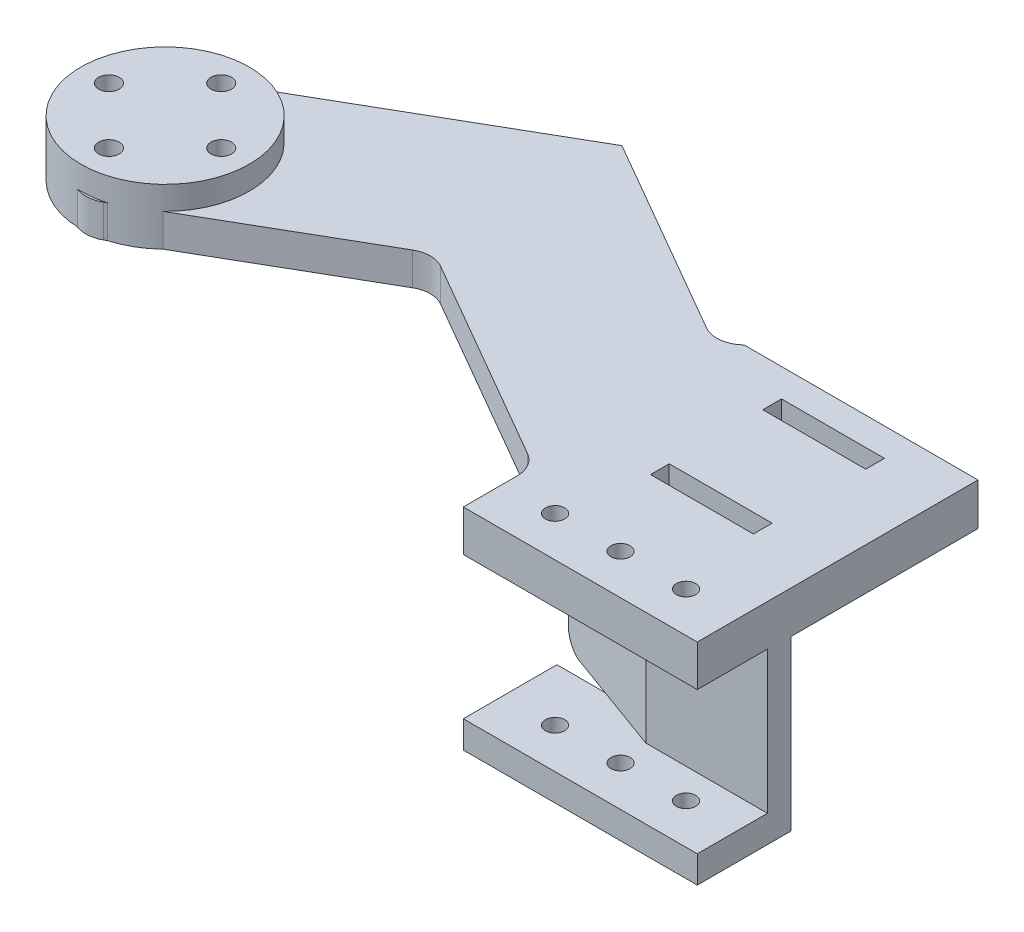
from build123d import *

# Parameters (mm, degrees)
SKETCH_1_W               = 25
SKETCH_1_H               = 10
EXTRUDE_1_DEPTH          = 22.5
SKETCH_2_W               = 25
SKETCH_2_H               = 15.2
CUT_EXTRUDE_1_DEPTH      = 7.5
CUT_EXTRUDE_2_DEPTH      = 36.089172119
CUT_EXTRUDE_2_DEPTH_BACK = 36.089172119
SKETCH_4_R               = 1.03
SKETCH_5_W               = 25
SKETCH_5_H               = 4.5
EXTRUDE_2_DEPTH          = 20
SKETCH_6_W               = 11
SKETCH_6_H               = 2
CUT_EXTRUDE_3_DEPTH      = 4.5
EXTRUDE_3_DEPTH          = 3.5
SKETCH_16_R              = 9
EXTRUDE_4_DEPTH          = 6
CUT_EXTRUDE_4_REACH      = 71.426
SKETCH_17_R              = 1.1
CUT_EXTRUDE_5_REACH      = 73.302
SKETCH_19_W              = 12
SKETCH_19_H              = 15.1
FILLET_7_R               = 3
EXTRUDE_6_REACH          = 72.338
CUT_EXTRUDE_6_REACH      = 72.847
SKETCH_22_W              = 7
SKETCH_22_H              = 5
FILLET_8_R               = 2


with BuildPart() as part:
    # 草图1 → 凸台-拉伸1 (new body)
    with BuildSketch(Plane(origin=(0, 0, 0), x_dir=(1, 0, 0), z_dir=(0, 1, 0))):
        with Locations((12.5, -5)):
            Rectangle(SKETCH_1_W, SKETCH_1_H)
    extrude(amount=EXTRUDE_1_DEPTH)

    # 草图2 → 切除-拉伸1 (cut)
    with BuildSketch(Plane.XY.offset(10)):
        with Locations((12.5, 10.5)):
            Rectangle(SKETCH_2_W, SKETCH_2_H)
    extrude(amount=-CUT_EXTRUDE_1_DEPTH, mode=Mode.SUBTRACT)

    # 草图4 → 切除-拉伸2 (cut, two sides: drawn at the far end of the back side and taken through both)
    with BuildSketch(Plane(origin=(0, 22.5, 0), x_dir=(1, 0, 0), z_dir=(0, 1, 0)).offset(-CUT_EXTRUDE_2_DEPTH_BACK)):
        with Locations(Location((12.5, -5.7, 0), (0, 0, 270))):
            Circle(SKETCH_4_R)
        with Locations(Location((19.5, -5.7, 0), (0, 0, 270))):
            Circle(SKETCH_4_R)
        with Locations(Location((5.5, -5.7, 0), (0, 0, 270))):
            Circle(SKETCH_4_R)
    extrude(amount=CUT_EXTRUDE_2_DEPTH + CUT_EXTRUDE_2_DEPTH_BACK, mode=Mode.SUBTRACT)

    # 草图5 → 凸台-拉伸2 (add)
    with BuildSketch(Plane(origin=(0, 0, 0), x_dir=(-1, 0, 0), z_dir=(0, 0, -1))):
        with Locations((-12.5, 20.25)):
            Rectangle(SKETCH_5_W, SKETCH_5_H)
    extrude(amount=EXTRUDE_2_DEPTH)

    # 草图6 → 切除-拉伸3 (cut)
    with BuildSketch(Plane(origin=(0, 22.5, 0), x_dir=(1, 0, 0), z_dir=(0, 1, 0))):
        with Locations((12.5, 16)):
            Rectangle(SKETCH_6_W, SKETCH_6_H)
        with Locations((12.5, 4)):
            Rectangle(SKETCH_6_W, SKETCH_6_H)
    extrude(amount=-CUT_EXTRUDE_3_DEPTH, mode=Mode.SUBTRACT)

    # 草图15 → 凸台-拉伸3 (add)
    with BuildSketch(Plane(origin=(0, 22.5, 0), x_dir=(1, 0, 0), z_dir=(0, 1, 0))):
        Polygon((0, 17.5), (0, -2.5), (-25, 11.93375673), (-50, -2.5), (-50, 17.5), (-24.967235844, 31.914840335), align=None)
    extrude(amount=-EXTRUDE_3_DEPTH)

    # 草图16 → 凸台-拉伸4 (add)
    with BuildSketch(Plane.XZ.offset(-19)):
        with Locations(Location((-49.655444566, -7.782050808, 0), (0, 0, 267.805955804))):
            Circle(SKETCH_16_R)
    extrude(amount=-EXTRUDE_4_DEPTH)

    # 草图17 → 切除-拉伸4 (cut, up to next)
    with BuildSketch(Plane.XZ.offset(-19), mode=Mode.PRIVATE) as cut_extrude_4_sk1:
        with Locations(Location((-55.655444566, -7.782050808, 0), (0, 0, 90))):
            Circle(SKETCH_17_R)
    cut_extrude_4_tool1 = extrude(cut_extrude_4_sk1.sketch, amount=-CUT_EXTRUDE_4_REACH, mode=Mode.PRIVATE) & part.part
    # 草图17 → 切除-拉伸4 (cut, up to next)
    with BuildSketch(Plane.XZ.offset(-19), mode=Mode.PRIVATE) as cut_extrude_4_sk2:
        with Locations(Location((-43.655444566, -7.782050808, 0), (0, 0, 90))):
            Circle(SKETCH_17_R)
    cut_extrude_4_tool2 = extrude(cut_extrude_4_sk2.sketch, amount=-CUT_EXTRUDE_4_REACH, mode=Mode.PRIVATE) & part.part
    # 草图17 → 切除-拉伸4 (cut, up to next)
    with BuildSketch(Plane.XZ.offset(-19), mode=Mode.PRIVATE) as cut_extrude_4_sk3:
        with Locations(Location((-49.655444566, -1.782050808, 0), (0, 0, 90))):
            Circle(SKETCH_17_R)
    cut_extrude_4_tool3 = extrude(cut_extrude_4_sk3.sketch, amount=-CUT_EXTRUDE_4_REACH, mode=Mode.PRIVATE) & part.part
    # 草图17 → 切除-拉伸4 (cut, up to next)
    with BuildSketch(Plane.XZ.offset(-19), mode=Mode.PRIVATE) as cut_extrude_4_sk4:
        with Locations(Location((-49.655444566, -13.782050808, 0), (0, 0, 90))):
            Circle(SKETCH_17_R)
    cut_extrude_4_tool4 = extrude(cut_extrude_4_sk4.sketch, amount=-CUT_EXTRUDE_4_REACH, mode=Mode.PRIVATE) & part.part
    add(cut_extrude_4_tool1.solids().sort_by_distance((-55.655445, 19, -7.782051))[0], mode=Mode.SUBTRACT)
    add(cut_extrude_4_tool2.solids().sort_by_distance((-43.655445, 19, -7.782051))[0], mode=Mode.SUBTRACT)
    add(cut_extrude_4_tool3.solids().sort_by_distance((-49.655445, 19, -1.782051))[0], mode=Mode.SUBTRACT)
    add(cut_extrude_4_tool4.solids().sort_by_distance((-49.655445, 19, -13.782051))[0], mode=Mode.SUBTRACT)

    # 草图19 → 切除-拉伸5 (cut, up to next)
    with BuildSketch(Plane(origin=(0, 0, 0), x_dir=(-1, 0, 0), z_dir=(0, 0, -1)), mode=Mode.PRIVATE) as cut_extrude_5_sk1:
        with Locations((-6, 10.45)):
            Rectangle(SKETCH_19_W, SKETCH_19_H)
    cut_extrude_5_tool1 = extrude(cut_extrude_5_sk1.sketch, amount=-CUT_EXTRUDE_5_REACH, mode=Mode.PRIVATE) & part.part
    add(cut_extrude_5_tool1.solids().sort_by_distance((6, 10.45, 0))[0], mode=Mode.SUBTRACT)

    # 圆角7
    # the kernel refuses this fillet: 3 mm, written as the material it adds along each edge
    with BuildSketch(Plane(origin=(0, 22.5, -17.5), x_dir=(-0.866025403784437, 0, -0.5000000000000027), z_dir=(0, -1, 0))) as fillet_7_piece_1:
        with BuildLine():
            CenterArc((4.131472029, 3), FILLET_7_R, 196.159495152, 73.840504848)
            Line((1.25, 2.165063509), (0, 0))
            Line((0, 0), (4.131472029, 0))
        make_face()
    extrude(amount=3.5)
    with BuildSketch(Plane(origin=(0, 22.5, 2.5), x_dir=(-0.8660254037844379, 0, -0.5000000000000012), z_dir=(0, -1, 0))) as fillet_7_piece_2:
        with BuildLine():
            CenterArc((FILLET_7_R * 0.57735026919, -FILLET_7_R), FILLET_7_R, 90, 60)
            Line((-FILLET_7_R * 0.288675134595, -FILLET_7_R * 0.5), (0, 0))
            Line((0, 0), (FILLET_7_R * 0.57735026919, 0))
        make_face()
    extrude(amount=3.5)
    with BuildSketch(Plane(origin=(-25, 22.5, -11.93375673), x_dir=(0.8660254037844384, 0, 0.5000000000000003), z_dir=(0, -1, 0))) as fillet_7_piece_3:
        with BuildLine():
            CenterArc((FILLET_7_R * 0.57735026919, FILLET_7_R), FILLET_7_R, 210, 60)
            Line((-FILLET_7_R * 0.288675134595, FILLET_7_R * 0.5), (0, 0))
            Line((0, 0), (FILLET_7_R * 0.57735026919, 0))
        make_face()
    extrude(amount=3.5)
    # the kernel refuses this fillet: 3 mm, written as the material it takes off along each edge
    with BuildSketch(Plane(origin=(-50, 29.947415965, 2.5), x_dir=(0, 0, -1), z_dir=(0, -1, 0))) as fillet_7_2_piece_1:
        with BuildLine():
            CenterArc((4.087559404, 1.079860567), FILLET_7_R, 150, 51.097341704)
            Line((1.489483193, 2.579860567), (0, 0))
            Line((0, 0), (1.288648696, 0))
        make_face()
    extrude(amount=18.394831929, mode=Mode.SUBTRACT)

    # 凸台-拉伸6: up to this face of the body (flat: up to its plane)
    extrude_6_end = Plane(part.part.faces().sort_by_distance((-27.69980279, 19, -14.058564272))[0])
    # 草图21 → 凸台-拉伸6 (add, up to the picked face)
    with BuildSketch(Plane(origin=(0, 2.9, 0), x_dir=(1, 0, 0), z_dir=(0, 1, 0)), mode=Mode.PRIVATE) as extrude_6_sk1:
        Polygon((5.131306451, 0), (12, 0), (-6.793852416, 6.840402867), (-7.597336928, 4.632847313), align=None)
    extrude_6_tool1 = split(extrude(extrude_6_sk1.sketch, amount=EXTRUDE_6_REACH, mode=Mode.PRIVATE), bisect_by=extrude_6_end, keep=Keep.BOTH, mode=Mode.PRIVATE)
    # 草图21 → 凸台-拉伸6 (add, up to the picked face)
    with BuildSketch(Plane(origin=(0, 2.9, 0), x_dir=(1, 0, 0), z_dir=(0, 1, 0)), mode=Mode.PRIVATE) as extrude_6_sk2:
        Polygon((5.131306451, 0), (12, -2.5), (12, 0), align=None)
    extrude_6_tool2 = split(extrude(extrude_6_sk2.sketch, amount=EXTRUDE_6_REACH, mode=Mode.PRIVATE), bisect_by=extrude_6_end, keep=Keep.BOTH, mode=Mode.PRIVATE)
    add(extrude_6_tool1.solids().sort_by(Axis((0.808046, 2.9, -2.903709), (0, 1, 0)))[0])
    add(extrude_6_tool2.solids().sort_by(Axis((9.710435, 2.9, 0.833333), (0, 1, 0)))[0])

    # 草图22 → 切除-拉伸6 (cut, up to next)
    with BuildSketch(Plane(origin=(1.403733341, 0, -3.856725658), x_dir=(-0.9396926207859082, 0, -0.3420201433256691), z_dir=(0.3420201433256691, 0, -0.9396926207859082)), mode=Mode.PRIVATE) as cut_extrude_6_sk1:
        with Locations((5.223688551, 5.4)):
            Rectangle(SKETCH_22_W, SKETCH_22_H)
    cut_extrude_6_tool1 = extrude(cut_extrude_6_sk1.sketch, amount=-CUT_EXTRUDE_6_REACH, mode=Mode.PRIVATE) & part.part
    add(cut_extrude_6_tool1.solids().sort_by_distance((-3.504928, 5.4, -5.643332))[0], mode=Mode.SUBTRACT)

    # 圆角8
    fillet_8_edges = [part.edges().sort_by_distance(p)[0] for p in [
        (-7.195594672, 7.9, -5.73662509),
        (-0.617746326, 2.9, -3.342484086),
        (-0.617746326, 7.9, -3.342484086),
    ]]
    fillet(fillet_8_edges, radius=FILLET_8_R)


solid = part.part
